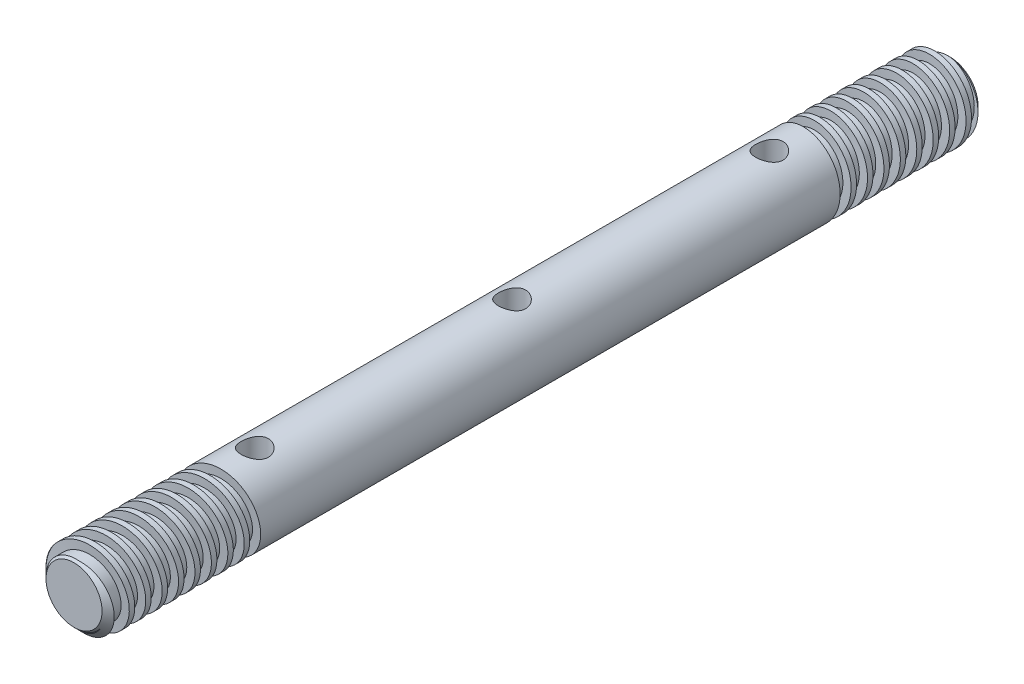
from build123d import *

# Parameters (mm, degrees)
SKETCH2_R               = 3.5
BOSS_EXTRUDE1_DEPTH     = 80
CUT_EXTRUDE1_DEPTH      = 10
CUT_EXTRUDE1_DEPTH_BACK = 10
SKETCH3_R               = 1.25
CUT_SWEEP3_PITCH        = 1.5


with BuildPart() as part:
    # Sketch2 → Boss-Extrude1 (new body)
    with BuildSketch(Plane.XY):
        Circle(SKETCH2_R)
    extrude(amount=BOSS_EXTRUDE1_DEPTH)

    # Sketch3 → Cut-Extrude1 (cut, two sides: drawn at the far end of the back side and taken through both)
    with BuildSketch(Plane(origin=(0, 0, 0), x_dir=(1, 0, 0), z_dir=(0, 1, 0)).offset(-CUT_EXTRUDE1_DEPTH_BACK)):
        with Locations(Location((0, -40, 0), (0, 0, 90))):
            Circle(SKETCH3_R)
        with Locations(Location((0, -16.5, 0), (0, 0, 90))):
            Circle(SKETCH3_R)
        with Locations(Location((0, -63.5, 0), (0, 0, 90))):
            Circle(SKETCH3_R)
    extrude(amount=CUT_EXTRUDE1_DEPTH + CUT_EXTRUDE1_DEPTH_BACK, mode=Mode.SUBTRACT)

    # Cut-Sweep3: arcs per turn and ends read off the stored shape
    # Cut-Sweep3: the profile of Sketch5 screwed along a right-hand helix through 9.5 turns, 8 arcs to a turn; built about Z, then put on its axis
    cut_sweep3_z = Axis((0, 0, 0), (0, 0, 1))
    cut_sweep3_corners = [(0, 4.25, -1.33498661), (0, 4.25, -0.33498661), (0, 2.75, -0.33498661), (0, 2.75, -1.33498661)]
    with BuildLine(mode=Mode.PRIVATE) as cut_sweep3_profile:
        Line(cut_sweep3_corners[0], cut_sweep3_corners[1])
        Line(cut_sweep3_corners[1], cut_sweep3_corners[2])
        Line(cut_sweep3_corners[2], cut_sweep3_corners[3])
        Line(cut_sweep3_corners[3], cut_sweep3_corners[0])
    cut_sweep3_cap = Face(cut_sweep3_profile.wire())
    cut_sweep3_turn_angles = [0, 22.5, 45, 67.5, 90, 112.5, 135, 157.5, 180, 202.5, 225, 247.5, 270, 292.5, 315, 337.5, 360]
    cut_sweep3_turn_weights = [1, 0.9238795325112867, 1, 0.9238795325112867, 1, 0.9238795325112867, 1, 0.9238795325112867, 1, 0.9238795325112867, 1, 0.9238795325112867, 1, 0.9238795325112867, 1, 0.9238795325112867, 1]
    cut_sweep3_turn_rails = [Edge.make_bspline([Vector(p[0], p[1], 0).rotate(cut_sweep3_z, cut_sweep3_turn_angles[k]) / cut_sweep3_turn_weights[k] + Vector(0, 0, p[2] + CUT_SWEEP3_PITCH * cut_sweep3_turn_angles[k] / 360) for k in range(17)], [0, 0, 0, 1, 1, 2, 2, 3, 3, 4, 4, 5, 5, 6, 6, 7, 7, 8, 8, 8], 2, cut_sweep3_turn_weights) for p in cut_sweep3_corners]
    cut_sweep3_turn_sides = [Face.make_surface_from_curves(cut_sweep3_turn_rails[p[0]], cut_sweep3_turn_rails[p[1]]) for p in [(0, 1), (1, 2), (2, 3), (3, 0)]]
    cut_sweep3_last_angles = [3240, 3262.5, 3285, 3307.5, 3330, 3352.5, 3375, 3397.5, 3420]
    cut_sweep3_last_weights = [1, 0.9238795325112867, 1, 0.9238795325112867, 1, 0.9238795325112867, 1, 0.9238795325112867, 1]
    cut_sweep3_last_rails = [Edge.make_bspline([Vector(p[0], p[1], 0).rotate(cut_sweep3_z, cut_sweep3_last_angles[k]) / cut_sweep3_last_weights[k] + Vector(0, 0, p[2] + CUT_SWEEP3_PITCH * cut_sweep3_last_angles[k] / 360) for k in range(9)], [0, 0, 0, 1, 1, 2, 2, 3, 3, 4, 4, 4], 2, cut_sweep3_last_weights) for p in cut_sweep3_corners]
    cut_sweep3_last_sides = [Face.make_surface_from_curves(cut_sweep3_last_rails[p[0]], cut_sweep3_last_rails[p[1]]) for p in [(0, 1), (1, 2), (2, 3), (3, 0)]]
    cut_sweep3 = Plane(origin=(0, 0, 80), x_dir=(-1, 0, 0), z_dir=(0, 0, -1)) * Solid(Shell([*[p.moved(Location((0, 0, CUT_SWEEP3_PITCH * i))) for i in range(9) for p in cut_sweep3_turn_sides], *cut_sweep3_last_sides, cut_sweep3_cap, cut_sweep3_cap.rotate(cut_sweep3_z, 3420).moved(Location((0, 0, CUT_SWEEP3_PITCH * 3420 / 360)))]))
    add(cut_sweep3, mode=Mode.SUBTRACT)

    # Sketch6 → Cut-Revolve1 (revolve, cut)
    with BuildSketch(Plane(origin=(0, 0, 0), x_dir=(0, 0, -1), z_dir=(1, 0, 0)), mode=Mode.PRIVATE) as cut_revolve1_sk:
        Polygon((-77.294850647, 5.264498794), (-81.237127146, 1.322222296), (-81.237127146, 0.304398181), (-83.115084314, 0.304398181), (-83.115084314, 5.264498794), align=None)
    cut_revolve1 = revolve(cut_revolve1_sk.sketch.rotate(Axis((0, 0, 61.783784569), (0, 0, 1)), 54.072725039), axis=Axis((0, 0, 61.783784569), (0, 0, 1)), mode=Mode.SUBTRACT)

    # Mirror1: Cut-Sweep3, Cut-Revolve1 across plane
    add(cut_sweep3.mirror(Plane(origin=(0, 0, 40), x_dir=(1, 0, 0), z_dir=(0, 0, -1))), mode=Mode.SUBTRACT)
    add(cut_revolve1.mirror(Plane(origin=(0, 0, 40), x_dir=(1, 0, 0), z_dir=(0, 0, -1))), mode=Mode.SUBTRACT)


solid = part.part
